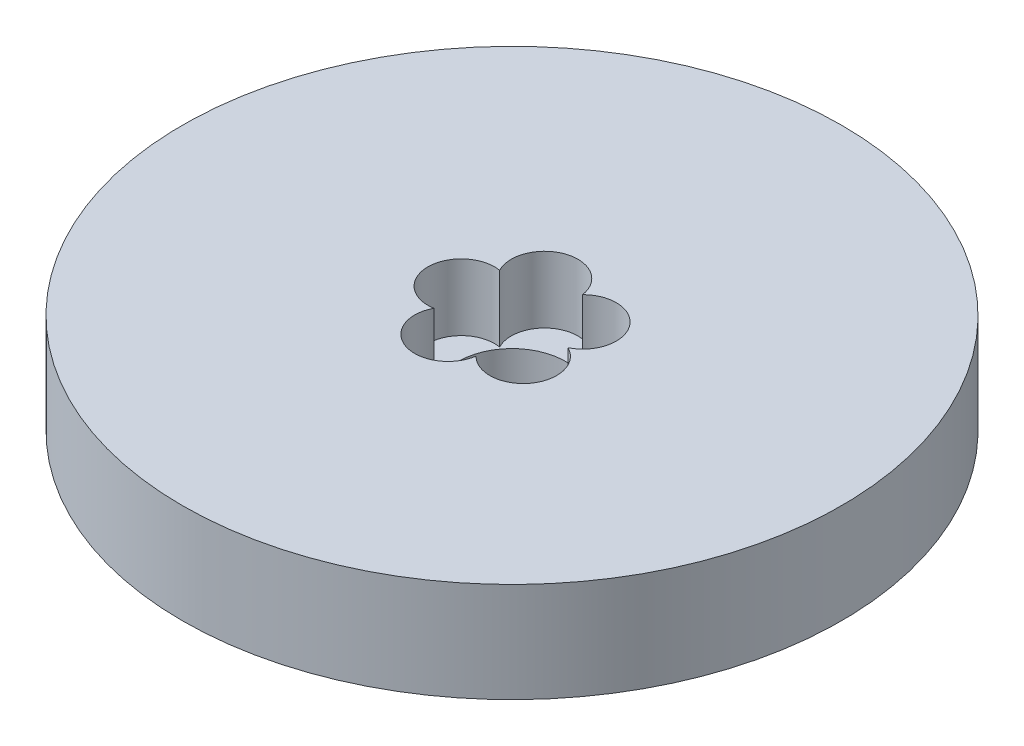
from build123d import *

# Parameters (mm, degrees)
SKETCH1_R           = 92.5
BOSS_EXTRUDE1_DEPTH = 28
SKETCH2_R           = 15
CUT_EXTRUDE1_DEPTH  = 134.777800849
SKETCH3_R           = 9.366362932
CUT_EXTRUDE2_DEPTH  = 18.658456181
CIRPATTERN1_COUNT   = 5


with BuildPart() as part:
    # Sketch1 → Boss-Extrude1 (new body)
    with BuildSketch(Plane(origin=(0, 0, 0), x_dir=(1, 0, 0), z_dir=(0, 1, 0))):
        Circle(SKETCH1_R)
    extrude(amount=BOSS_EXTRUDE1_DEPTH)

    # Sketch2 → Cut-Extrude1 (cut, through all)
    with BuildSketch(Plane(origin=(0, 0, 0), x_dir=(1, 0, 0), z_dir=(0, 1, 0))):
        Circle(SKETCH2_R)
    extrude(amount=CUT_EXTRUDE1_DEPTH, mode=Mode.SUBTRACT)

    # Sketch3 → Cut-Extrude2 (cut)
    with BuildSketch(Plane(origin=(0, 28, 0), x_dir=(1, 0, 0), z_dir=(0, 1, 0))):
        with Locations((-14.249853525, 0)):
            Circle(SKETCH3_R)
    cut_extrude2 = extrude(amount=-CUT_EXTRUDE2_DEPTH, mode=Mode.SUBTRACT)

    # CirPattern1: Cut-Extrude2 ×5 about axis
    cirpattern1_axis = Axis((0, 0, 0), (0, 1, 0))
    for i in range(1, CIRPATTERN1_COUNT):
        add(cut_extrude2.rotate(cirpattern1_axis, i * 360 / CIRPATTERN1_COUNT), mode=Mode.SUBTRACT)


solid = part.part
